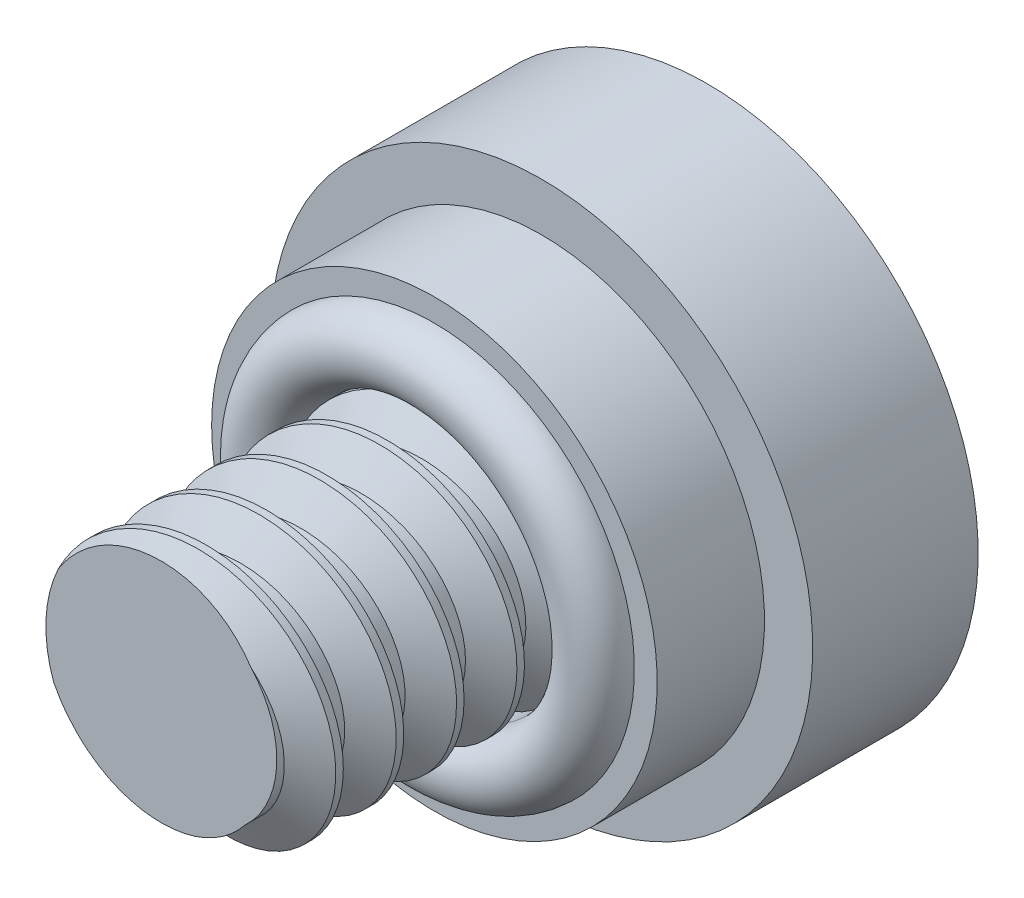
from build123d import *

# Parameters (mm, degrees)
SKETCH1_R           = 2.31
BOSS_EXTRUDE1_DEPTH = 4.5
THREAD1_PITCH       = 1.058333333


with BuildPart() as part:
    # Sketch1 → Boss-Extrude1 (new body)
    with BuildSketch(Plane.XY):
        Circle(SKETCH1_R)
    extrude(amount=BOSS_EXTRUDE1_DEPTH)

    # Sketch2 → Revolve1 (revolve)
    with BuildSketch(Plane(origin=(0, 0, 0), x_dir=(1, 0, 0), z_dir=(0, 1, 0)), mode=Mode.PRIVATE) as revolve1_sk:
        with BuildLine():
            Line((3.505, 0), (3.905, 0))
            Line((3.905, 0), (3.905, 1.88))
            Line((3.905, 1.88), (4.75, 1.88))
            Line((4.75, 1.88), (4.75, 4.78))
            Line((4.75, 4.78), (0.876943086, 4.78))
            Line((0.876943086, 4.78), (0.876943086, 4.68))
            Line((0.876943086, 4.68), (0, 4.68))
            Line((0, 4.68), (0, 0))
            Line((0, 0), (2.31, 0))
            ThreePointArc((2.31, 0), (2.9075, -0.5975), (3.505, 0))
        make_face()
    revolve(revolve1_sk.sketch.rotate(Axis((0, 0, -4.68), (0, 0, 1)), 180), axis=Axis((0, 0, -4.68), (0, 0, 1)))

    # Thread1: the profile of Thread Profile1 profile screwed along a right-hand helix of 5.19685 turns, 8 arcs to a turn; built about Z, then put on its axis
    thread1_z = Axis((0, 0, 0), (0, 0, 1))
    thread1_corners = [(2.3103, 0, -0.000173205), (2.3103, 0, 0.926214869), (1.737160282, 0, 0.595312499), (1.737160282, 0, 0.330729165)]
    with BuildLine(mode=Mode.PRIVATE) as thread1_profile:
        Line(thread1_corners[0], thread1_corners[1])
        Line(thread1_corners[1], thread1_corners[2])
        Line(thread1_corners[2], thread1_corners[3])
        Line(thread1_corners[3], thread1_corners[0])
    thread1_cap = Face(thread1_profile.wire())
    thread1_turn_angles = [0, 22.5, 45, 67.5, 90, 112.5, 135, 157.5, 180, 202.5, 225, 247.5, 270, 292.5, 315, 337.5, 360]
    thread1_turn_weights = [1, 0.9238795325112867, 1, 0.9238795325112867, 1, 0.9238795325112867, 1, 0.9238795325112867, 1, 0.9238795325112867, 1, 0.9238795325112867, 1, 0.9238795325112867, 1, 0.9238795325112867, 1]
    thread1_turn_rails = [Edge.make_bspline([Vector(p[0], p[1], 0).rotate(thread1_z, thread1_turn_angles[k]) / thread1_turn_weights[k] + Vector(0, 0, p[2] + THREAD1_PITCH * thread1_turn_angles[k] / 360) for k in range(17)], [0, 0, 0, 1, 1, 2, 2, 3, 3, 4, 4, 5, 5, 6, 6, 7, 7, 8, 8, 8], 2, thread1_turn_weights) for p in thread1_corners]
    thread1_turn_sides = [Face.make_surface_from_curves(thread1_turn_rails[p[0]], thread1_turn_rails[p[1]]) for p in [(0, 1), (1, 2), (2, 3), (3, 0)]]
    thread1_last_angles = [1800, 1822.5, 1845, 1857.933070866, 1870.866141732]
    thread1_last_weights = [1, 0.9238795325112867, 1, 0.9746321728627872, 1]
    thread1_last_rails = [Edge.make_bspline([Vector(p[0], p[1], 0).rotate(thread1_z, thread1_last_angles[k]) / thread1_last_weights[k] + Vector(0, 0, p[2] + THREAD1_PITCH * thread1_last_angles[k] / 360) for k in range(5)], [0, 0, 0, 1, 1, 2, 2, 2], 2, thread1_last_weights) for p in thread1_corners]
    thread1_last_sides = [Face.make_surface_from_curves(thread1_last_rails[p[0]], thread1_last_rails[p[1]]) for p in [(0, 1), (1, 2), (2, 3), (3, 0)]]
    thread1 = Plane(origin=(0, 0, 5.5), x_dir=(-1, 0, 0), z_dir=(0, 0, -1)) * Solid(Shell([*[p.moved(Location((0, 0, THREAD1_PITCH * i))) for i in range(5) for p in thread1_turn_sides], *thread1_last_sides, thread1_cap, thread1_cap.rotate(thread1_z, 1870.866141732).moved(Location((0, 0, THREAD1_PITCH * 1870.866141732 / 360)))]))
    add(thread1, mode=Mode.SUBTRACT)


solid = part.part
